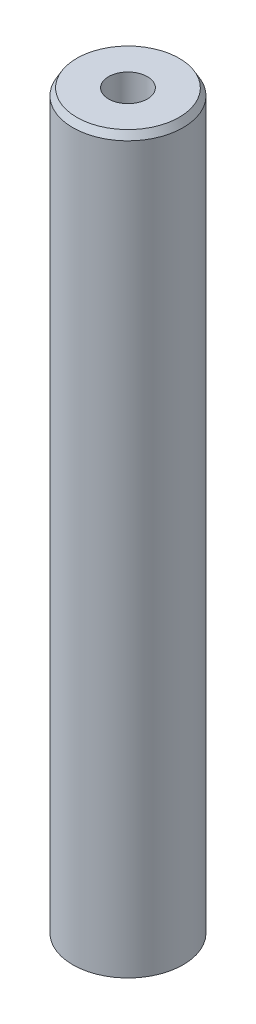
from build123d import *
from OCP.BRepFilletAPI import BRepFilletAPI_MakeChamfer

# Parameters (mm, degrees)
SKETCH1_R           = 45
BOSS_EXTRUDE1_DEPTH = 600
SKETCH2_R           = 15.819826925
CUT_EXTRUDE1_DEPTH  = 604.365560834
CHAMFER1_SIZE       = 5.639486255
CHAMFER1_SIZE2      = 3.255958907


with BuildPart() as part:
    # Sketch1 → Boss-Extrude1 (new body)
    with BuildSketch(Plane(origin=(0, 0, 0), x_dir=(1, 0, 0), z_dir=(0, 1, 0))):
        Circle(SKETCH1_R)
    extrude(amount=BOSS_EXTRUDE1_DEPTH)

    # Sketch2 → Cut-Extrude1 (cut, through all)
    with BuildSketch(Plane(origin=(0, 0, 0), x_dir=(1, 0, 0), z_dir=(0, 1, 0))):
        Circle(SKETCH2_R)
    extrude(amount=CUT_EXTRUDE1_DEPTH, mode=Mode.SUBTRACT)

    # Chamfer1: one chamfer whose edges measure the first distance from different faces: ONE call of the kernel's chamfer builder (chamfer() names one face for all edges)
    chamfer1_edges_1 = [part.edges().sort_by_distance(p)[0] for p in [
        (-45, 600, 0),
    ]]
    chamfer1_side_1 = [part.faces().sort_by_distance(p)[0] for p in [
        (-45, 300, 0),
    ]]
    chamfer1_edges_2 = [part.edges().sort_by_distance(p)[0] for p in [
        (-45, 0, 0),
    ]]
    chamfer1_side_2 = [part.faces().sort_by_distance(p)[0] for p in [
        (-43.727207794, 0, 0),
    ]]
    chamfer1 = BRepFilletAPI_MakeChamfer(part.part.solid().wrapped)
    for e in chamfer1_edges_1:
        chamfer1.Add(CHAMFER1_SIZE, CHAMFER1_SIZE2, e.wrapped, chamfer1_side_1[0].wrapped)  # the first distance lies on this face
    for e in chamfer1_edges_2:
        chamfer1.Add(CHAMFER1_SIZE, CHAMFER1_SIZE2, e.wrapped, chamfer1_side_2[0].wrapped)  # the first distance lies on this face
    add(Compound.cast(chamfer1.Shape()), mode=Mode.REPLACE)


solid = part.part
